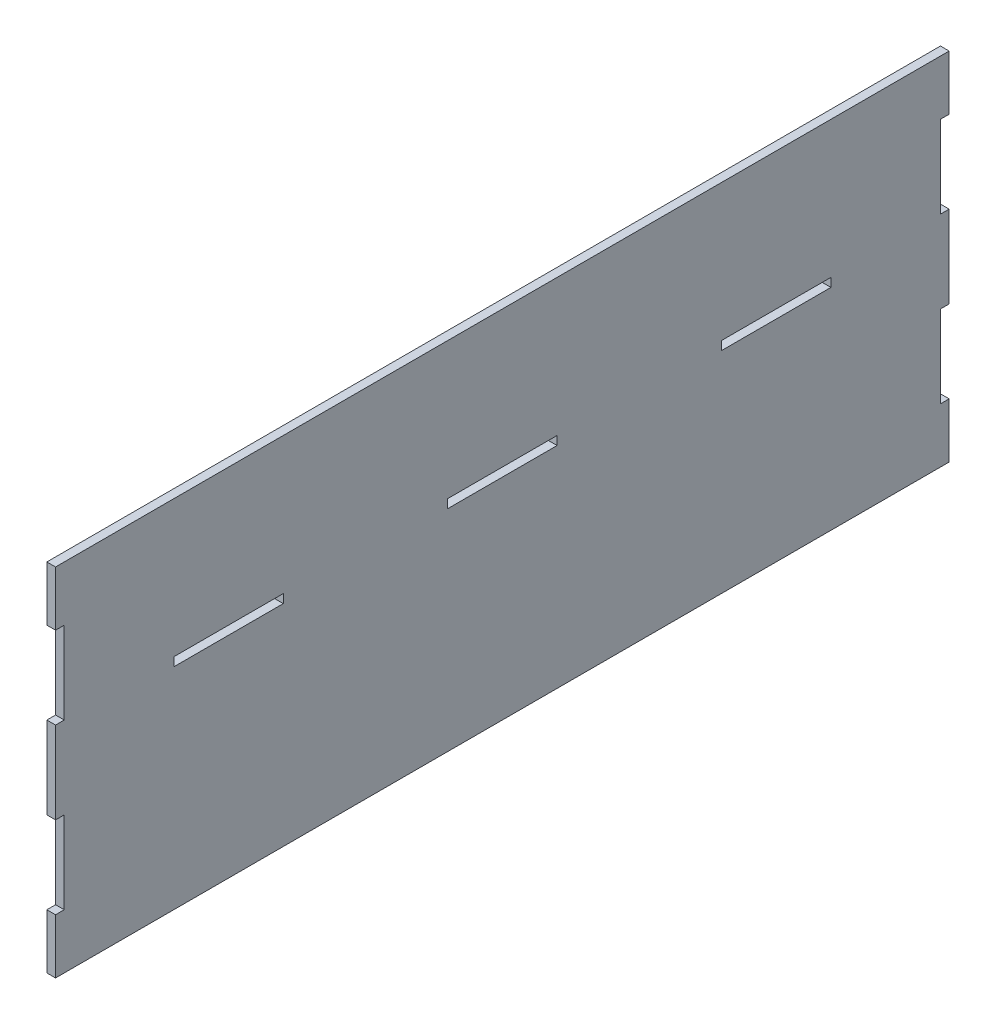
from build123d import *

# Parameters (mm, degrees)
SKETCH1_W           = 326.35
SKETCH1_H           = 130
BOSS_EXTRUDE1_DEPTH = 3.175
SKETCH2_W           = 40
SKETCH2_H           = 3.175
SKETCH2_W_2         = 3.175
SKETCH2_H_2         = 30
CUT_EXTRUDE1_DEPTH  = 10


with BuildPart() as part:
    # Sketch1 → Boss-Extrude1 (new body)
    with BuildSketch(Plane(origin=(0, 0, 0), x_dir=(0, 0, -1), z_dir=(1, 0, 0))):
        with Locations((163.175, -65)):
            Rectangle(SKETCH1_W, SKETCH1_H)
    extrude(amount=BOSS_EXTRUDE1_DEPTH)

    # Sketch2 → Cut-Extrude1 (cut)
    with BuildSketch(Plane(origin=(3.175, 0, 0), x_dir=(0, 0, -1), z_dir=(1, 0, 0))):
        with Locations((63.175, -51.5875)):
            Rectangle(SKETCH2_W, SKETCH2_H)
        with Locations((163.175, -51.5875)):
            Rectangle(SKETCH2_W, SKETCH2_H)
        with Locations((263.175, -51.5875)):
            Rectangle(SKETCH2_W, SKETCH2_H)
        with Locations((324.7625, -35)):
            Rectangle(SKETCH2_W_2, SKETCH2_H_2)
        with Locations((324.7625, -95)):
            Rectangle(SKETCH2_W_2, SKETCH2_H_2)
        with Locations((1.5875, -35)):
            Rectangle(SKETCH2_W_2, SKETCH2_H_2)
        with Locations((1.5875, -95)):
            Rectangle(SKETCH2_W_2, SKETCH2_H_2)
    extrude(amount=-CUT_EXTRUDE1_DEPTH, mode=Mode.SUBTRACT)


solid = part.part
